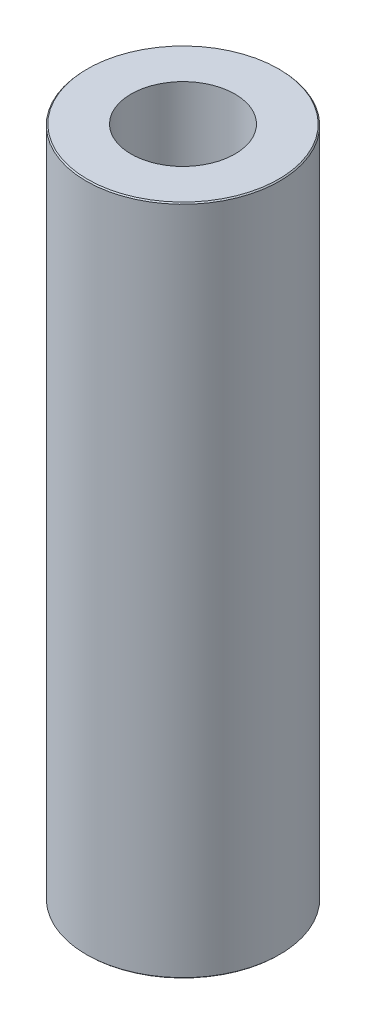
from build123d import *
from OCP.BRepFilletAPI import BRepFilletAPI_MakeChamfer

# Parameters (mm, degrees)
SKETCH1_R           = 42.5
BOSS_EXTRUDE1_DEPTH = 295.367295865
SKETCH2_R           = 22.853391795
CUT_EXTRUDE1_DEPTH  = 302.420535907
CHAMFER1_SIZE       = 0.49798496
CHAMFER1_SIZE2      = 0.478995011


with BuildPart() as part:
    # Sketch1 → Boss-Extrude1 (new body)
    with BuildSketch(Plane(origin=(0, 0, 0), x_dir=(1, 0, 0), z_dir=(0, 1, 0))):
        Circle(SKETCH1_R)
    extrude(amount=BOSS_EXTRUDE1_DEPTH)

    # Sketch2 → Cut-Extrude1 (cut, through all)
    with BuildSketch(Plane(origin=(0, 0, 0), x_dir=(1, 0, 0), z_dir=(0, 1, 0))):
        Circle(SKETCH2_R)
    extrude(amount=CUT_EXTRUDE1_DEPTH, mode=Mode.SUBTRACT)

    # Chamfer1: one chamfer whose edges measure the first distance from different faces: ONE call of the kernel's chamfer builder (chamfer() names one face for all edges)
    chamfer1_edges_1 = [part.edges().sort_by_distance(p)[0] for p in [
        (-42.5, 295.367295865, 0),
    ]]
    chamfer1_side_1 = [part.faces().sort_by_distance(p)[0] for p in [
        (-42.5, 147.683647933, 0),
    ]]
    chamfer1_edges_2 = [part.edges().sort_by_distance(p)[0] for p in [
        (-42.5, 0, 0),
    ]]
    chamfer1_side_2 = [part.faces().sort_by_distance(p)[0] for p in [
        (-41.297918472, 0, 0),
    ]]
    chamfer1 = BRepFilletAPI_MakeChamfer(part.part.solid().wrapped)
    for e in chamfer1_edges_1:
        chamfer1.Add(CHAMFER1_SIZE, CHAMFER1_SIZE2, e.wrapped, chamfer1_side_1[0].wrapped)  # the first distance lies on this face
    for e in chamfer1_edges_2:
        chamfer1.Add(CHAMFER1_SIZE, CHAMFER1_SIZE2, e.wrapped, chamfer1_side_2[0].wrapped)  # the first distance lies on this face
    add(Compound.cast(chamfer1.Shape()), mode=Mode.REPLACE)


solid = part.part
